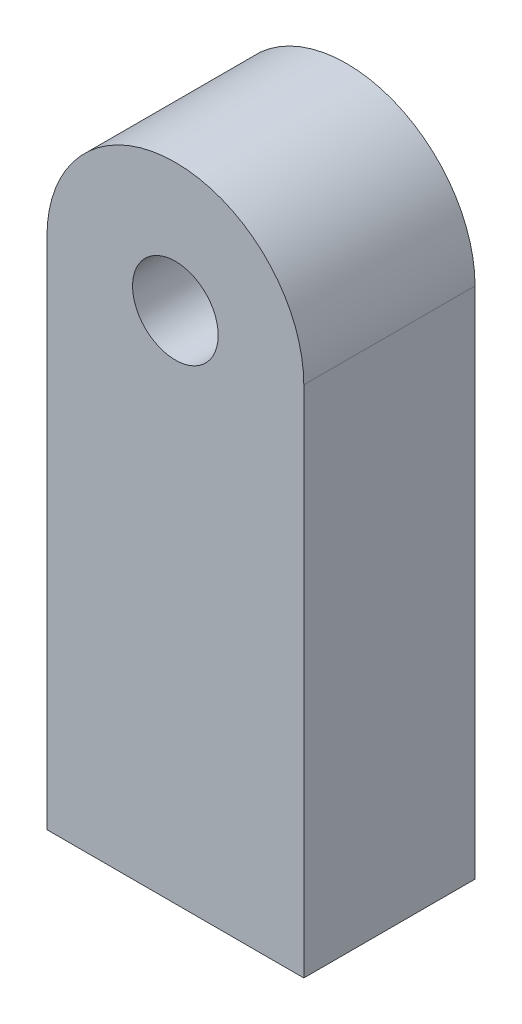
from build123d import *

# Parameters (mm, degrees)
BOSS_EXTRUDE1_DEPTH      = 6.35
BOSS_EXTRUDE1_DEPTH_BACK = 6.35
SKETCH1_R                = 3.175


with BuildPart() as part:
    # Sketch1 → Boss-Extrude1 (new, two sides: drawn at the far end of the back side and taken through both)
    with BuildSketch(Plane.XY.offset(-BOSS_EXTRUDE1_DEPTH_BACK)):
        with BuildLine():
            Line((-60.003481739, 12.679905588), (-60.003481739, 50.779905588))
            ThreePointArc((-60.003481739, 50.779905588), (-50.478481739, 60.304905588), (-40.953481739, 50.779905588))
            Line((-40.953481739, 50.779905588), (-40.953481739, 12.679905588))
            Line((-40.953481739, 12.679905588), (-60.003481739, 12.679905588))
        make_face()
        with Locations((-50.478481739, 50.779905588)):
            Circle(SKETCH1_R, mode=Mode.SUBTRACT)
    extrude(amount=BOSS_EXTRUDE1_DEPTH + BOSS_EXTRUDE1_DEPTH_BACK)


solid = part.part
